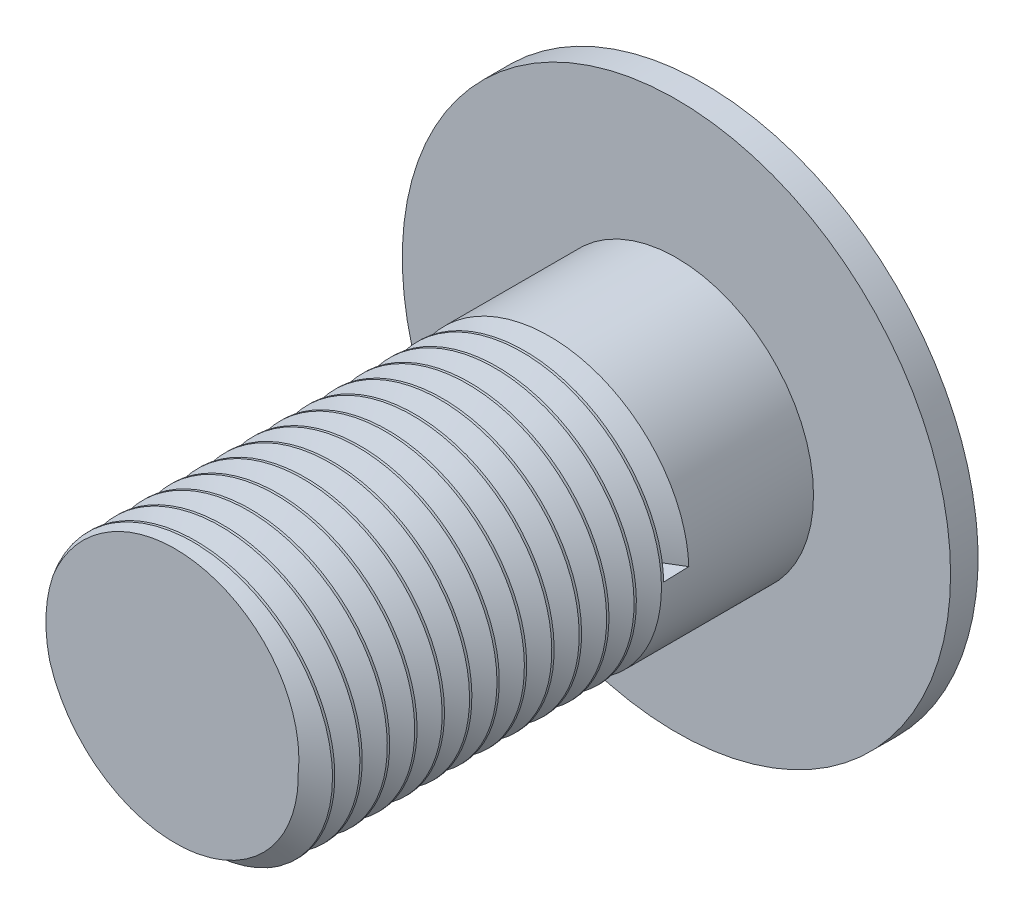
from build123d import *

# Parameters (mm, degrees)
SKETCH1_R           = 2.5
BOSS_EXTRUDE1_DEPTH = 12
SKETCH4_W           = 11.031864246
SKETCH4_H           = 1.25
CUT_EXTRUDE1_DEPTH  = 2
CUT_SWEEP1_PITCH    = 0.5
SKETCH7_R           = 3.98582897
CUT_EXTRUDE2_DEPTH  = 3


with BuildPart() as part:
    # Sketch1 → Boss-Extrude1 (new body)
    with BuildSketch(Plane.XY):
        Circle(SKETCH1_R)
    extrude(amount=BOSS_EXTRUDE1_DEPTH)

    # Sketch2 → Revolve2 (revolve)
    with BuildSketch(Plane(origin=(0, 0, 0), x_dir=(0, 0, -1), z_dir=(1, 0, 0)), mode=Mode.PRIVATE) as revolve2_sk:
        with BuildLine():
            Line((0, 0), (0, 5))
            Line((0, 5), (0.5, 5))
            add(Edge.make_bspline(
                [(1.827762538, 0), (1.827762538, 1.830149357), (1.519553174, 3.428686124), (0.5, 5)],
                knots=[0, 0, 0, 0, 1, 1, 1, 1], degree=3))
            Line((1.827762538, 0), (0, 0))
        make_face()
    revolve(revolve2_sk.sketch.rotate(Axis((0, 0, 0), (0, 0, -1)), 90), axis=Axis((0, 0, 0), (0, 0, -1)))

    # Sketch4 → Cut-Extrude1 (cut)
    with BuildSketch(Plane.XY.offset(-0.5)):
        with Locations((-0.041796822, 0)):
            Rectangle(SKETCH4_W, SKETCH4_H)
    extrude(amount=-CUT_EXTRUDE1_DEPTH, mode=Mode.SUBTRACT)

    # Cut-Sweep1: arcs per turn and ends read off the stored shape
    # Cut-Sweep1: the profile of Sketch6 screwed along a right-hand helix through 20 turns, 6 arcs to a turn; built about Z, then put on its axis
    cut_sweep1_z = Axis((0, 0, 0), (0, 0, 1))
    cut_sweep1_corners = [(2.519613423, 0.007740304, -0.743168808), (2.103921229, 0.000104734, -0.503290301), (2.519613423, -0.007530836, -0.263411794)]
    with BuildLine(mode=Mode.PRIVATE) as cut_sweep1_profile:
        Line(cut_sweep1_corners[0], cut_sweep1_corners[1])
        Line(cut_sweep1_corners[1], cut_sweep1_corners[2])
        Line(cut_sweep1_corners[2], cut_sweep1_corners[0])
    cut_sweep1_cap = Face(cut_sweep1_profile.wire())
    cut_sweep1_turn_angles = [0, 30, 60, 90, 120, 150, 180, 210, 240, 270, 300, 330, 360]
    cut_sweep1_turn_weights = [1, 0.8660254037844387, 1, 0.8660254037844387, 1, 0.8660254037844387, 1, 0.8660254037844387, 1, 0.8660254037844387, 1, 0.8660254037844387, 1]
    cut_sweep1_turn_rails = [Edge.make_bspline([Vector(p[0], p[1], 0).rotate(cut_sweep1_z, cut_sweep1_turn_angles[k]) / cut_sweep1_turn_weights[k] + Vector(0, 0, p[2] + CUT_SWEEP1_PITCH * cut_sweep1_turn_angles[k] / 360) for k in range(13)], [0, 0, 0, 1, 1, 2, 2, 3, 3, 4, 4, 5, 5, 6, 6, 6], 2, cut_sweep1_turn_weights) for p in cut_sweep1_corners]
    cut_sweep1_turn_sides = [Face.make_surface_from_curves(cut_sweep1_turn_rails[p[0]], cut_sweep1_turn_rails[p[1]]) for p in [(0, 1), (1, 2), (2, 0)]]
    cut_sweep1 = Plane(origin=(0, 0, 12), x_dir=(1, 0, 0), z_dir=(0, 0, -1)) * Solid(Shell([*[p.moved(Location((0, 0, CUT_SWEEP1_PITCH * i))) for i in range(20) for p in cut_sweep1_turn_sides], cut_sweep1_cap, cut_sweep1_cap.rotate(cut_sweep1_z, 7200).moved(Location((0, 0, CUT_SWEEP1_PITCH * 7200 / 360)))]))
    add(cut_sweep1, mode=Mode.SUBTRACT)

    # Sketch7 → Cut-Extrude2 (cut)
    with BuildSketch(Plane.XY.offset(12)):
        Circle(SKETCH7_R)
    extrude(amount=-CUT_EXTRUDE2_DEPTH, mode=Mode.SUBTRACT)


solid = part.part
